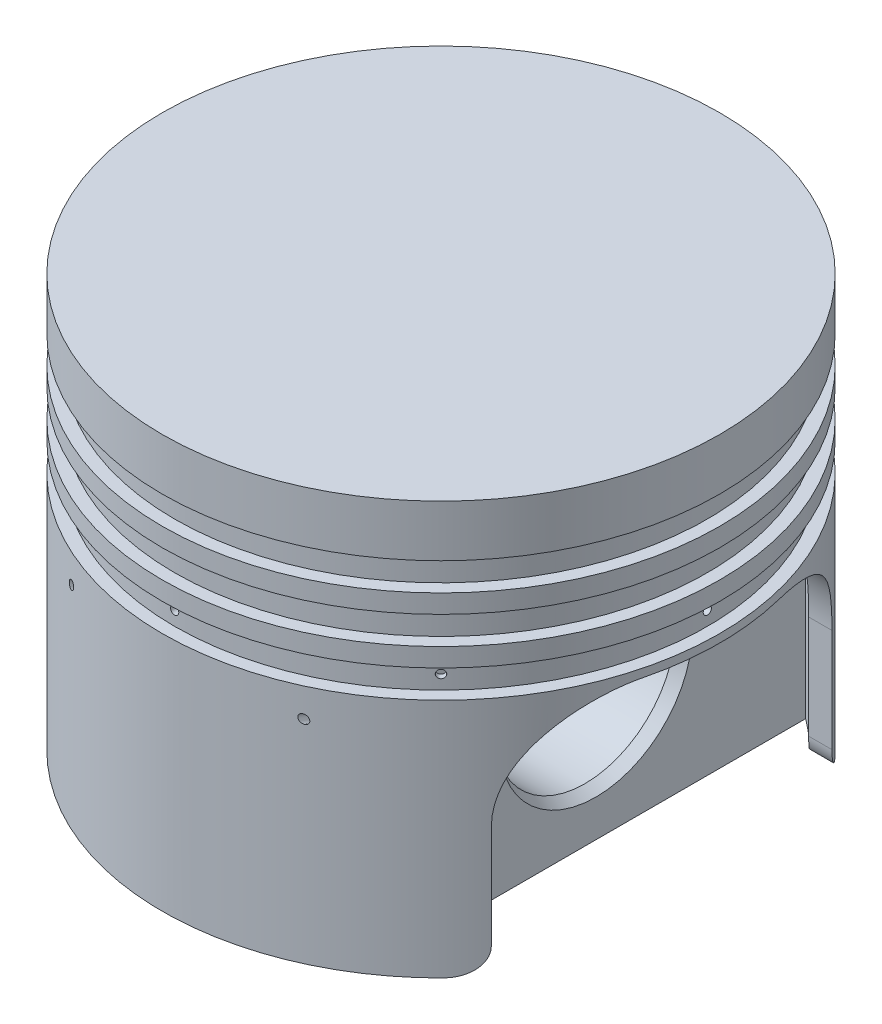
from build123d import *
from OCP.BRepFilletAPI import BRepFilletAPI_MakeChamfer

# Parameters (mm, degrees)
CUT_EXTRUDE2_DEPTH        = 111.598372502
CUT_EXTRUDE2_DEPTH_BACK   = 111.598372502
SKETCH5_W                 = 66
SKETCH5_H                 = 45
SKETCH6_W                 = 4.8
SKETCH6_H                 = 5.4
LPATTERN2_COUNT           = 2
LPATTERN2_PITCH           = 9
FILLET1_R                 = 20
LPATTERN4_COPY_1_SKETCH_W = 4.8
LPATTERN4_COPY_1_SKETCH_H = 5.4
LPATTERN4_COPY_2_SKETCH_W = 4.8
LPATTERN4_COPY_2_SKETCH_H = 5.4
BOSS_EXTRUDE3_START       = 70.87
SKETCH19_W                = 15
SKETCH19_H                = 50
BOSS_EXTRUDE3_DEPTH       = 70.87
SKETCH20_R                = 17.5
CUT_EXTRUDE4_DEPTH        = 128.953116476
FILLET8_R                 = 5
CIRPATTERN3_COUNT         = 8
SKETCH42_R                = 0.8
CUT_EXTRUDE5_DEPTH        = 50
MIRROR2_COPY_1_SKETCH_R   = 0.8
MIRROR2_COPY_1_DEPTH      = 50
FILLET4_R                 = 4
FILLET18_R                = 8
CHAMFER2_SIZE             = 2.1
CHAMFER2_SIZE2            = 1.212435565


# Some blends are built 0.0001 mm under size
with BuildPart() as part:
    # Sketch4 → Revolve2 (revolve)
    with BuildSketch(Plane.XY, mode=Mode.PRIVATE) as revolve2_sk:
        Polygon((0, 0), (0, -9.13), (50.5, -9.13), (50.5, -80), (54, -80), (54, 0), align=None)
    revolve(revolve2_sk.sketch.rotate(Axis((0, 0, 0), (0, -1, 0)), 180), axis=Axis((0, 0, 0), (0, -1, 0)))

    # Sketch5 → Cut-Extrude2 (cut, two sides: drawn at the far end of the back side and taken through both)
    with BuildSketch(Plane(origin=(0, 0, 0), x_dir=(0, 0, -1), z_dir=(1, 0, 0)).offset(-CUT_EXTRUDE2_DEPTH_BACK)):
        with Locations((0, -57.5)):
            Rectangle(SKETCH5_W, SKETCH5_H)
    extrude(amount=CUT_EXTRUDE2_DEPTH + CUT_EXTRUDE2_DEPTH_BACK, mode=Mode.SUBTRACT)

    # Sketch6 → Cut-Revolve2 (revolve, cut)
    with BuildSketch(Plane(origin=(0, 0, 0), x_dir=(0, 0, -1), z_dir=(1, 0, 0)), mode=Mode.PRIVATE) as cut_revolve2_sk:
        with Locations((54, -12.7)):
            Rectangle(SKETCH6_W, SKETCH6_H)
    cut_revolve2 = revolve(cut_revolve2_sk.sketch.rotate(Axis((0, 0, 0), (0, -1, 0)), 270), axis=Axis((0, 0, 0), (0, -1, 0)), mode=Mode.SUBTRACT)

    # LPattern2: Cut-Revolve2 ×2
    with Locations(*[(0, -i * LPATTERN2_PITCH, 0) for i in range(1, LPATTERN2_COUNT)]):
        add(cut_revolve2, mode=Mode.SUBTRACT)

    # Fillet1
    # the kernel refuses this fillet: 20 mm, written as the material it adds along each edge
    with BuildSketch(Plane(origin=(-92.743420546, -35, -33), x_dir=(0, 0, 1), z_dir=(1, 0, 0))) as fillet1_piece_1_section:
        with BuildLine():
            CenterArc((FILLET1_R, FILLET1_R), FILLET1_R, 180, 90)
            Line((0, FILLET1_R), (0, 0))
            Line((0, 0), (FILLET1_R, 0))
        make_face()
    fillet1_piece_1 = extrude(amount=104.517120699, mode=Mode.PRIVATE)
    fillet1_piece_1 = fillet1_piece_1 - Plane(origin=(0, -39.583946122, 0), x_dir=(-1, 0, 0), z_dir=(0, -1, 0)) * Cylinder(50.5, 290, mode=Mode.PRIVATE)
    fillet1_piece_1 = fillet1_piece_1 & Plane(origin=(0, -39.583946122, 0), x_dir=(-1, 0, 0), z_dir=(0, 1, 0)) * Cylinder(54, 290, mode=Mode.PRIVATE)
    add(fillet1_piece_1)
    with BuildSketch(Plane(origin=(-11.773700153, -35, -33), x_dir=(0, -1, 0), z_dir=(1, 0, 0))) as fillet1_piece_2_section:
        with BuildLine():
            CenterArc((FILLET1_R, -FILLET1_R), FILLET1_R, 90, 90)
            Line((0, -FILLET1_R), (0, 0))
            Line((0, 0), (FILLET1_R, 0))
        make_face()
    fillet1_piece_2 = extrude(amount=104.517120699, mode=Mode.PRIVATE)
    fillet1_piece_2 = fillet1_piece_2 - Plane(origin=(0, -39.583957247, 0), x_dir=(-1, 0, 0), z_dir=(0, -1, 0)) * Cylinder(50.5, 290, mode=Mode.PRIVATE)
    fillet1_piece_2 = fillet1_piece_2 & Plane(origin=(0, -39.583957247, 0), x_dir=(-1, 0, 0), z_dir=(0, 1, 0)) * Cylinder(54, 290, mode=Mode.PRIVATE)
    add(fillet1_piece_2)
    with BuildSketch(Plane(origin=(11.773700153, -35, 33), x_dir=(0, 0, -1), z_dir=(-1, 0, 0))) as fillet1_piece_3_section:
        with BuildLine():
            CenterArc((FILLET1_R, FILLET1_R), FILLET1_R, 180, 90)
            Line((0, FILLET1_R), (0, 0))
            Line((0, 0), (FILLET1_R, 0))
        make_face()
    fillet1_piece_3 = extrude(amount=104.517120699, mode=Mode.PRIVATE)
    fillet1_piece_3 = fillet1_piece_3 - Plane(origin=(0, -39.583945258, 0), x_dir=(-1, 0, 0), z_dir=(0, -1, 0)) * Cylinder(50.5, 290, mode=Mode.PRIVATE)
    fillet1_piece_3 = fillet1_piece_3 & Plane(origin=(0, -39.583945258, 0), x_dir=(-1, 0, 0), z_dir=(0, 1, 0)) * Cylinder(54, 290, mode=Mode.PRIVATE)
    add(fillet1_piece_3)
    with BuildSketch(Plane(origin=(92.743420546, -35, 33), x_dir=(0, 0, -1), z_dir=(-1, 0, 0))) as fillet1_piece_4_section:
        with BuildLine():
            CenterArc((FILLET1_R, FILLET1_R), FILLET1_R, 180, 90)
            Line((0, FILLET1_R), (0, 0))
            Line((0, 0), (FILLET1_R, 0))
        make_face()
    fillet1_piece_4 = extrude(amount=104.517120699, mode=Mode.PRIVATE)
    fillet1_piece_4 = fillet1_piece_4 - Plane(origin=(0, -39.583946122, 0), x_dir=(-1, 0, 0), z_dir=(0, -1, 0)) * Cylinder(50.5, 290, mode=Mode.PRIVATE)
    fillet1_piece_4 = fillet1_piece_4 & Plane(origin=(0, -39.583946122, 0), x_dir=(-1, 0, 0), z_dir=(0, 1, 0)) * Cylinder(54, 290, mode=Mode.PRIVATE)
    add(fillet1_piece_4)

    # LPattern4 copy 1 sketch → LPattern4 copy 1 (revolve, cut)
    with BuildSketch(Plane(origin=(0, -18, 0), x_dir=(0, 0, -1), z_dir=(1, 0, 0))):
        with Locations((54, -12.7)):
            Rectangle(LPATTERN4_COPY_1_SKETCH_W, LPATTERN4_COPY_1_SKETCH_H)
    revolve(axis=Axis((0, -18, 0), (0, -1, 0)), mode=Mode.SUBTRACT)

    # LPattern4 copy 2 sketch → LPattern4 copy 2 (revolve, cut)
    with BuildSketch(Plane(origin=(0, -9, 0), x_dir=(0, 0, -1), z_dir=(1, 0, 0))):
        with Locations((54, -12.7)):
            Rectangle(LPATTERN4_COPY_2_SKETCH_W, LPATTERN4_COPY_2_SKETCH_H)
    revolve(axis=Axis((0, -9, 0), (0, -1, 0)), mode=Mode.SUBTRACT)

    # Sketch19 → Boss-Extrude3 (add)
    with BuildSketch(Plane.XZ.offset(9.13).offset(BOSS_EXTRUDE3_START)):
        with BuildLine():
            Line((-15, 25), (-15, 48.220846115))
            ThreePointArc((-15, 48.220846115), (-22.81843101, 45.050740352), (-30, 40.623269194))
            Line((-30, 40.623269194), (-30, 25))
            Line((-30, 25), (-15, 25))
        make_face()
        with Locations((-22.5, 0)):
            Rectangle(SKETCH19_W, SKETCH19_H)
        with BuildLine():
            ThreePointArc((-30, -40.623269194), (-22.81843101, -45.050740352), (-15, -48.220846115))
            Line((-15, -48.220846115), (-15, -25))
            Line((-15, -25), (-30, -25))
            Line((-30, -25), (-30, -40.623269194))
        make_face()
        with BuildLine():
            Line((15, 25), (30, 25))
            Line((30, 25), (30, 40.623269194))
            ThreePointArc((30, 40.623269194), (22.81843101, 45.050740352), (15, 48.220846115))
            Line((15, 48.220846115), (15, 25))
        make_face()
        with Locations((22.5, 0)):
            Rectangle(SKETCH19_W, SKETCH19_H)
        with BuildLine():
            Line((30, -40.623269194), (30, -25))
            Line((30, -25), (15, -25))
            Line((15, -25), (15, -48.220846115))
            ThreePointArc((15, -48.220846115), (22.81843101, -45.050740352), (30, -40.623269194))
        make_face()
    extrude(amount=-BOSS_EXTRUDE3_DEPTH)

    # Sketch20 → Cut-Extrude4 (cut, through all)
    with BuildSketch(Plane.ZY.offset(30)):
        with Locations(Location((0, -54.13, 0), (0, 0, 270))):
            Circle(SKETCH20_R)
    extrude(amount=-CUT_EXTRUDE4_DEPTH, mode=Mode.SUBTRACT)

    # Fillet8
    fillet8_edges = [part.edges().sort_by_distance(p)[0] for p in [
        (-40.484860197, -80, -33),
        (40.484860197, -80, -33),
        (40.484860197, -80, 33),
        (-40.484860197, -80, 33),
    ]]
    fillet(fillet8_edges, radius=FILLET8_R)

    # Sketch23 → 1/16 (0.0625) Diameter Hole3 (revolve, cut)
    with BuildSketch(Plane(origin=(0, -30.7, 47), x_dir=(0, 1, 0), z_dir=(1, 0, 0))):
        Polygon((0, 0), (0, 4.6), (0.79375, 4.6), (0.79375, 0.635), (1.42875, 0), align=None)
    f_1_16_0_0625_diameter_hole3 = revolve(axis=Axis((0, -30.7, 40.65), (0, 0, 1)), mode=Mode.SUBTRACT)

    # CirPattern3: 1/16 (0.0625) Diameter Hole3 ×8 about axis
    cirpattern3_axis = Axis((0, -18, 0), (0, 1, 0))
    for i in range(1, CIRPATTERN3_COUNT):
        add(f_1_16_0_0625_diameter_hole3.rotate(cirpattern3_axis, i * 360 / CIRPATTERN3_COUNT), mode=Mode.SUBTRACT)

    # Sketch42 → Cut-Extrude5 (cut)
    with BuildSketch(Plane(origin=(22.5, -37, 54), x_dir=(1, 0, 0), z_dir=(0, 0.36796506850761784, 0.9298396143196871))):
        with Locations(Location((0, 0, 0), (0, 0, 270))):
            Circle(SKETCH42_R)
    cut_extrude5 = extrude(amount=-CUT_EXTRUDE5_DEPTH, mode=Mode.SUBTRACT)

    # Mirror1: Cut-Extrude5 across plane
    add(cut_extrude5.mirror(Plane(origin=(0, 0, 0), x_dir=(0, 0, 1), z_dir=(1, 0, 0))), mode=Mode.SUBTRACT)

    # Mirror2: Cut-Extrude5 across plane
    add(cut_extrude5.mirror(Plane.XY), mode=Mode.SUBTRACT)

    # Mirror2 copy 1 sketch → Mirror2 copy 1 (cut)
    with BuildSketch(Plane(origin=(-22.5, -37, -54), x_dir=(-1, 0, 0), z_dir=(0, 0.36796506850761784, -0.9298396143196871))):
        with Locations(Location((0, 0, 0), (0, 0, 270))):
            Circle(MIRROR2_COPY_1_SKETCH_R)
    extrude(amount=-MIRROR2_COPY_1_DEPTH, mode=Mode.SUBTRACT)

    # Fillet4
    # the kernel refuses this fillet: 4 mm, written as the material it adds along each edge
    with BuildSketch(Plane(origin=(0, -9.13, 0), x_dir=(0.42409595090131663, 0, -0.9056172615565077), z_dir=(-0.9056172615565077, 0, -0.42409595090131663))) as fillet4_piece_1:
        with BuildLine():
            CenterArc((50.5 - FILLET4_R, FILLET4_R), FILLET4_R, 270, 90)
            Line((50.5 - FILLET4_R, 0), (50.5, 0))
            Line((50.5, 0), (50.5, FILLET4_R))
        make_face()
    revolve(axis=Axis((0, -9.13, 0), (0, -1, 0)), revolution_arc=129.813093078)
    with BuildSketch(Plane(origin=(0, -9.13, 0), x_dir=(-0.4240959509013166, 0, -0.9056172615565077), z_dir=(0.9056172615565077, 0, -0.4240959509013166))) as fillet4_piece_2:
        with BuildLine():
            CenterArc((50.5 - FILLET4_R, -FILLET4_R), FILLET4_R, 360, 90)
            Line((50.5 - FILLET4_R, 0), (50.5, 0))
            Line((50.5, 0), (50.5, -FILLET4_R))
        make_face()
    revolve(axis=Axis((0, -9.13, 0), (0, 1, 0)), revolution_arc=129.813093078)
    with BuildSketch(Plane(origin=(-30, -9.13, 50.623269194), x_dir=(0, -1, 0), z_dir=(0, 0, -1))) as fillet4_piece_3_section:
        with BuildLine():
            CenterArc((FILLET4_R, FILLET4_R), FILLET4_R, 180, 90)
            Line((0, FILLET4_R), (0, 0))
            Line((0, 0), (FILLET4_R, 0))
        make_face()
    fillet4_piece_3 = extrude(amount=101.246538388, mode=Mode.PRIVATE)
    fillet4_piece_3 = fillet4_piece_3 & Plane(origin=(0, -10.044224635, 0), x_dir=(-1, 0, 0), z_dir=(0, -1, 0)) * Cylinder(50.5, 219, mode=Mode.PRIVATE)
    add(fillet4_piece_3)
    with BuildSketch(Plane(origin=(30, -9.13, 50.623269194), x_dir=(0, -1, 0), z_dir=(0, 0, -1))) as fillet4_piece_4_section:
        with BuildLine():
            CenterArc((FILLET4_R, -FILLET4_R), FILLET4_R, 90, 90)
            Line((0, -FILLET4_R), (0, 0))
            Line((0, 0), (FILLET4_R, 0))
        make_face()
    fillet4_piece_4 = extrude(amount=101.246538388, mode=Mode.PRIVATE)
    fillet4_piece_4 = fillet4_piece_4 & Plane(origin=(0, -10.044224608, 0), x_dir=(-1, 0, 0), z_dir=(0, -1, 0)) * Cylinder(50.5, 219, mode=Mode.PRIVATE)
    add(fillet4_piece_4)

    # Fillet18
    fillet18_edges = [part.edges().sort_by_distance(p)[0] for p in [
        (0, -9.13, 50.5),
        (0, -9.13, -50.5),
        (-15, -9.13, 0),
        (15, -9.13, 0),
    ]]
    fillet(fillet18_edges, radius=FILLET18_R - 0.0001)  # a hair under: the kernel refuses the full size

    # Chamfer2: one chamfer whose edges measure the first distance from different faces: ONE call of the kernel's chamfer builder (chamfer() names one face for all edges)
    chamfer2_edges_1 = [part.edges().sort_by_distance(p)[0] for p in [
        (30, -36.63, 0),
    ]]
    chamfer2_side_1 = [part.faces().sort_by_distance(p)[0] for p in [
        (22.5, -36.63, 0),
    ]]
    chamfer2_edges_2 = [part.edges().sort_by_distance(p)[0] for p in [
        (15, -36.63, 0),
    ]]
    chamfer2_side_2 = [part.faces().sort_by_distance(p)[0] for p in [
        (15, -48.56495, 47.069601159),
    ]]
    chamfer2_edges_3 = [part.edges().sort_by_distance(p)[0] for p in [
        (-15, -36.63, 0),
    ]]
    chamfer2_side_3 = [part.faces().sort_by_distance(p)[0] for p in [
        (-22.5, -36.63, 0),
    ]]
    chamfer2_edges_4 = [part.edges().sort_by_distance(p)[0] for p in [
        (-30, -36.63, 0),
    ]]
    chamfer2_side_4 = [part.faces().sort_by_distance(p)[0] for p in [
        (-30, -46.565, -39.571005116),
    ]]
    chamfer2 = BRepFilletAPI_MakeChamfer(part.part.solid().wrapped)
    for e in chamfer2_edges_1:
        chamfer2.Add(CHAMFER2_SIZE, CHAMFER2_SIZE2, e.wrapped, chamfer2_side_1[0].wrapped)  # the first distance lies on this face
    for e in chamfer2_edges_2:
        chamfer2.Add(CHAMFER2_SIZE, CHAMFER2_SIZE2, e.wrapped, chamfer2_side_2[0].wrapped)  # the first distance lies on this face
    for e in chamfer2_edges_3:
        chamfer2.Add(CHAMFER2_SIZE, CHAMFER2_SIZE2, e.wrapped, chamfer2_side_3[0].wrapped)  # the first distance lies on this face
    for e in chamfer2_edges_4:
        chamfer2.Add(CHAMFER2_SIZE, CHAMFER2_SIZE2, e.wrapped, chamfer2_side_4[0].wrapped)  # the first distance lies on this face
    add(Compound.cast(chamfer2.Shape()), mode=Mode.REPLACE)


solid = part.part
